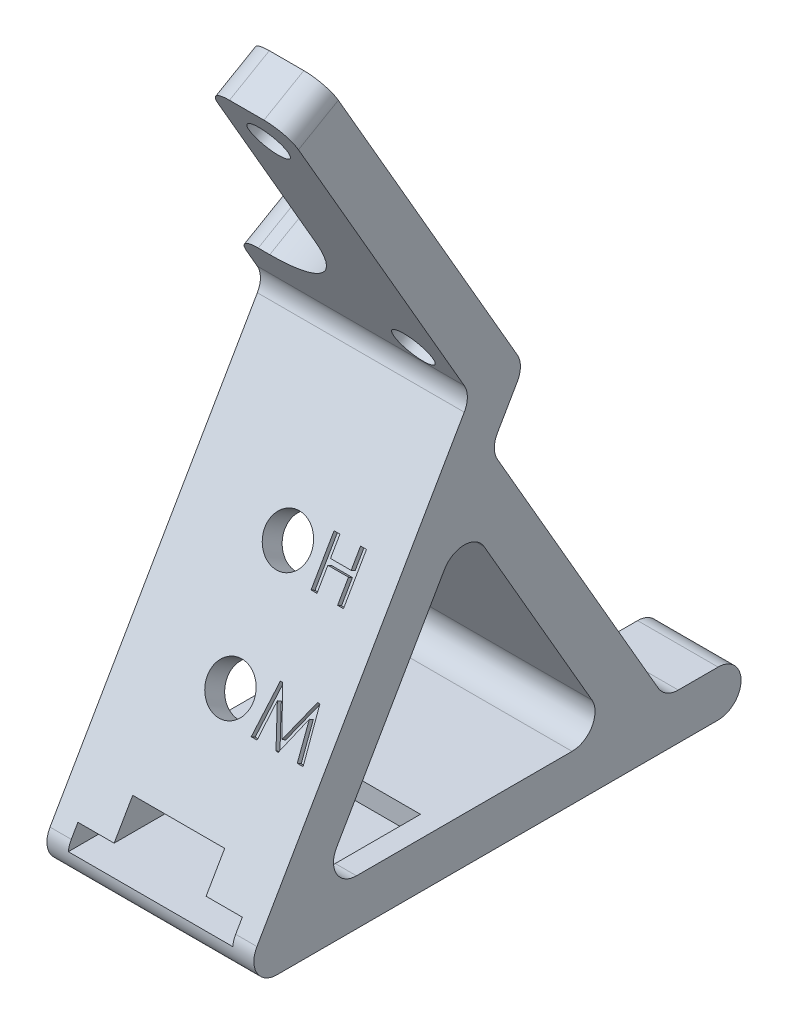
from build123d import *

# Parameters (mm, degrees)
BOSS_EXTRU_1_DEPTH      = 18
D_GAGEMENT_M31_D        = 3.4
ENL_V_MAT_EXTRU_5_REACH = 82.979
ESQUISSE7_W             = 11
ESQUISSE7_H             = 27
ENL_V_MAT_EXTRU_6_DEPTH = 11
ESQUISSE4_W             = 14.3
ESQUISSE4_H             = 17.809401077
ENL_V_MAT_EXTRU_1_DEPTH = 1.8
ENL_V_MAT_EXTRU_2_REACH = 83.214
ESQUISSE5_W             = 8
ESQUISSE5_H             = 2.8
ENL_V_MAT_EXTRU_3_REACH = 63.446
ENL_V_START             = -2
ESQUISSE6_W             = 7.2
ESQUISSE6_H             = 6.45
ENL_V_MAT_EXTRU_4_REACH = 61.446
ESQUISSE6_3_R           = 2
ENL_V_MAT_EXTRU_7_DEPTH = 0.4
CONG_1_R                = 2
CONG_2_R                = 8


with BuildPart() as part:
    # Esquisse1 → Boss.-Extru.1 (new body)
    with BuildSketch(Plane(origin=(0, 0, 0), x_dir=(0, 0, -1), z_dir=(1, 0, 0))):
        Polygon((-37.5, 64.951905284), (-40.964101615, 62.951905284), (-24.964101615, 35.239092363), (-45.309401077, 0), (0, 0), (-2.309401077, 4), (-8.082903769, 4), (-23.232050808, 30.239092363), (-20.345299462, 35.239092363), align=None)
        Polygon((-38.381197846, 4), (-12.701705922, 4), (-25.541451884, 26.239092363), align=None, mode=Mode.SUBTRACT)
    extrude(amount=BOSS_EXTRU_1_DEPTH)

    # Dégagement M31 (through all)
    with Locations(Plane(origin=(0, 0, 0), x_dir=(-1, 0, 0), z_dir=(0, 0.5000000000000047, -0.866025403784436))):
        with Locations((-14.5, 71.2), (-14.5, 46)):
            Hole(D_GAGEMENT_M31_D / 2)

    # Esquisse7 → Enlèv. mat.-Extru.5 (cut, up to next)
    with BuildSketch(Plane(origin=(0, -2, 3.464101615), x_dir=(1, 0, 0), z_dir=(0, -0.5000000000000047, 0.8660254037844359)), mode=Mode.PRIVATE) as enl_v_mat_extru_5_sk1:
        with Locations((5.5, 61.5)):
            Rectangle(ESQUISSE7_W, ESQUISSE7_H)
    enl_v_mat_extru_5_tool1 = extrude(enl_v_mat_extru_5_sk1.sketch, amount=-ENL_V_MAT_EXTRU_5_REACH, mode=Mode.PRIVATE) & part.part
    add(enl_v_mat_extru_5_tool1.solids().sort_by_distance((5.5, 51.260562, 34.214102))[0], mode=Mode.SUBTRACT)

    # Esquisse8 → Enlèv. mat.-Extru.6 (cut)
    with BuildSketch(Plane.ZY):
        Polygon((0, 0), (2.309401077, 4), (8.082903769, 4), (5.773502692, 0), align=None)
    extrude(amount=-ENL_V_MAT_EXTRU_6_DEPTH, mode=Mode.SUBTRACT)

    # Esquisse4 → Enlèv. mat.-Extru.1 (cut)
    with BuildSketch(Plane(origin=(0, 4, 0), x_dir=(1, 0, 0), z_dir=(0, 1, 0))):
        with Locations((9, -36.404700539)):
            Rectangle(ESQUISSE4_W, ESQUISSE4_H)
    extrude(amount=-ENL_V_MAT_EXTRU_1_DEPTH, mode=Mode.SUBTRACT)

    # Enlèv. mat.-Extru.2: up to this plane
    enl_v_mat_extru_2_end = Plane(origin=(18, 26.239092363, 25.541451884), z_dir=(0, -0.5000000000000034, -0.8660254037844367))
    # Esquisse5 → Enlèv. mat.-Extru.2 (cut, up to the surface)
    with BuildSketch(Plane(origin=(0, 0, 45.309401077), x_dir=(-1, 0, 0), z_dir=(0, 0, -1)), mode=Mode.PRIVATE) as enl_v_mat_extru_2_sk1:
        with Locations((-9, 5.4)):
            Rectangle(ESQUISSE5_W, ESQUISSE5_H)
    enl_v_mat_extru_2_tool1 = split(extrude(enl_v_mat_extru_2_sk1.sketch, amount=ENL_V_MAT_EXTRU_2_REACH, mode=Mode.PRIVATE), bisect_by=enl_v_mat_extru_2_end, keep=Keep.BOTH, mode=Mode.PRIVATE)
    add(enl_v_mat_extru_2_tool1.solids().sort_by_distance((9, 5.4, 45.309401))[0], mode=Mode.SUBTRACT)

    # Esquisse6 → Enlèv. mat.-Extru.3 (cut, up to next)
    with BuildSketch(Plane(origin=(0, 19.619546181, 33.982050808), x_dir=(1, 0, 0), z_dir=(0, 0.5000000000000042, 0.8660254037844363)).offset(ENL_V_START), mode=Mode.PRIVATE) as enl_v_mat_extru_3_sk1:
        with Locations((9, -5.802736877)):
            Rectangle(ESQUISSE6_W, ESQUISSE6_H)
    enl_v_mat_extru_3_tool1 = extrude(enl_v_mat_extru_3_sk1.sketch, amount=-ENL_V_MAT_EXTRU_3_REACH, mode=Mode.PRIVATE) & part.part
    # Esquisse6 → Enlèv. mat.-Extru.3 (cut, up to next)
    with BuildSketch(Plane(origin=(0, 19.619546181, 33.982050808), x_dir=(1, 0, 0), z_dir=(0, 0.5000000000000042, 0.8660254037844363)).offset(ENL_V_START), mode=Mode.PRIVATE) as enl_v_mat_extru_3_sk2:
        with Locations((9, 4.197263123)):
            Rectangle(ESQUISSE6_W, ESQUISSE6_H)
    enl_v_mat_extru_3_tool2 = extrude(enl_v_mat_extru_3_sk2.sketch, amount=-ENL_V_MAT_EXTRU_3_REACH, mode=Mode.PRIVATE) & part.part
    add(enl_v_mat_extru_3_tool1.solids().sort_by_distance((9, 13.594229, 35.151368))[0], mode=Mode.SUBTRACT)
    add(enl_v_mat_extru_3_tool2.solids().sort_by_distance((9, 22.254483, 30.151368))[0], mode=Mode.SUBTRACT)

    # Esquisse6<3> → Enlèv. mat.-Extru.4 (cut, up to next)
    with BuildSketch(Plane(origin=(0, 19.619546181, 33.982050808), x_dir=(1, 0, 0), z_dir=(0, 0.5000000000000042, 0.8660254037844363)), mode=Mode.PRIVATE) as enl_v_mat_extru_4_sk1:
        with Locations(Location((9, -5.802736877, 0), (0, 0, 270))):
            Circle(ESQUISSE6_3_R)
    enl_v_mat_extru_4_tool1 = extrude(enl_v_mat_extru_4_sk1.sketch, amount=-ENL_V_MAT_EXTRU_4_REACH, mode=Mode.PRIVATE) & part.part
    # Esquisse6<3> → Enlèv. mat.-Extru.4 (cut, up to next)
    with BuildSketch(Plane(origin=(0, 19.619546181, 33.982050808), x_dir=(1, 0, 0), z_dir=(0, 0.5000000000000042, 0.8660254037844363)), mode=Mode.PRIVATE) as enl_v_mat_extru_4_sk2:
        with Locations(Location((9, 4.197263123, 0), (0, 0, 270))):
            Circle(ESQUISSE6_3_R)
    enl_v_mat_extru_4_tool2 = extrude(enl_v_mat_extru_4_sk2.sketch, amount=-ENL_V_MAT_EXTRU_4_REACH, mode=Mode.PRIVATE) & part.part
    add(enl_v_mat_extru_4_tool1.solids().sort_by_distance((9, 14.594229, 36.883419))[0], mode=Mode.SUBTRACT)
    add(enl_v_mat_extru_4_tool2.solids().sort_by_distance((9, 23.254483, 31.883419))[0], mode=Mode.SUBTRACT)

    # Esquisse9 → Enlèv. mat.-Extru.7 (cut)
    with BuildSketch(Plane(origin=(0, 19.619546181, 33.982050808), x_dir=(1, 0, 0), z_dir=(0, 0.5000000000000042, 0.8660254037844363))):
        Polygon((12.012820513, 6.197263123), (12.525641026, 6.197263123), (12.525641026, 4.556237482), (14.320512821, 4.556237482), (14.320512821, 6.197263123), (14.833333333, 6.197263123), (14.833333333, 2.197263123), (14.320512821, 2.197263123), (14.320512821, 4.09469902), (12.525641026, 4.09469902), (12.525641026, 2.197263123), (12.012820513, 2.197263123), align=None)
        Polygon((11.807692308, -7.802736877), (12.342147436, -3.802736877), (12.544070513, -3.802736877), (14.060897436, -6.982224057), (15.577724359, -3.802736877), (15.782852564, -3.802736877), (16.320512821, -7.802736877), (15.811698718, -7.802736877), (15.455929487, -4.982224057), (14.157852564, -7.802736877), (13.963942308, -7.802736877), (12.669871795, -4.982224057), (12.315705128, -7.802736877), align=None)
    extrude(amount=-ENL_V_MAT_EXTRU_7_DEPTH, mode=Mode.SUBTRACT)

    # Congé1
    # the kernel refuses this fillet: 2 mm, written as the material it adds along each edge
    with BuildSketch(Plane(origin=(0, 4, 38.381197846), x_dir=(0, 0.8660254037844363, -0.5000000000000039), z_dir=(1, 0, 0)), Plane(origin=(16.15, 4, 38.381197846), x_dir=(0, 0.8660254037844363, -0.5000000000000039), z_dir=(1, 0, 0))) as cong_1_piece_1:
        with BuildLine():
            CenterArc((CONG_1_R * 1.73205080757, -CONG_1_R), CONG_1_R, 90, 120)
            Line((CONG_1_R * 0.866025403784, -CONG_1_R * 1.5), (0, 0))
            Line((0, 0), (CONG_1_R * 1.73205080757, 0))
        make_face()
    extrude(amount=1.85)
    with BuildSketch(Plane(origin=(0, 4, 12.701705922), x_dir=(0, 0.8660254037844365, 0.5000000000000036), z_dir=(1, 0, 0))) as cong_1_piece_2:
        with BuildLine():
            CenterArc((CONG_1_R * 1.73205080757, CONG_1_R), CONG_1_R, 150, 120)
            Line((CONG_1_R * 0.866025403784, CONG_1_R * 1.5), (0, 0))
            Line((0, 0), (CONG_1_R * 1.73205080757, 0))
        make_face()
    extrude(amount=18)
    with BuildSketch(Plane(origin=(0, 26.239092363, 25.541451884), x_dir=(0, -0.8660254037844365, 0.500000000000004), z_dir=(1, 0, 0))) as cong_1_piece_3_section:
        with BuildLine():
            CenterArc((CONG_1_R * 1.73205080757, CONG_1_R), CONG_1_R, 150, 120)
            Line((CONG_1_R * 0.866025403784, CONG_1_R * 1.5), (0, 0))
            Line((0, 0), (CONG_1_R * 1.73205080757, 0))
        make_face()
    cong_1_piece_3 = extrude(amount=26.660254038, mode=Mode.PRIVATE)
    cong_1_piece_3 = split(cong_1_piece_3, bisect_by=Plane(origin=(5.4, 23.813443604, 26.862688053), z_dir=(-1, 0, 0)), keep=Keep.TOP, mode=Mode.PRIVATE)
    add(cong_1_piece_3)
    with BuildSketch(Plane(origin=(-8.660254038, 26.239092363, 25.541451884), x_dir=(0, -0.8660254037844365, 0.500000000000004), z_dir=(1, 0, 0))) as cong_1_piece_4_section:
        with BuildLine():
            CenterArc((CONG_1_R * 1.73205080757, CONG_1_R), CONG_1_R, 150, 120)
            Line((CONG_1_R * 0.866025403784, CONG_1_R * 1.5), (0, 0))
            Line((0, 0), (CONG_1_R * 1.73205080757, 0))
        make_face()
    cong_1_piece_4 = extrude(amount=26.660254038, mode=Mode.PRIVATE)
    cong_1_piece_4 = split(cong_1_piece_4, bisect_by=Plane(origin=(9, 23.670920351, 26.154710464), z_dir=(0, 0.8660254037844363, -0.5000000000000042)), keep=Keep.TOP, mode=Mode.PRIVATE)
    cong_1_piece_4 = split(cong_1_piece_4, bisect_by=Plane(origin=(5.4, 24.793273023, 25.506719847), z_dir=(1, 0, 0)), keep=Keep.TOP, mode=Mode.PRIVATE)
    add(cong_1_piece_4)
    with BuildSketch(Plane(origin=(-8.660254038, 26.239092363, 25.541451884), x_dir=(0, -0.8660254037844365, 0.500000000000004), z_dir=(1, 0, 0))) as cong_1_piece_5_section:
        with BuildLine():
            CenterArc((CONG_1_R * 1.73205080757, CONG_1_R), CONG_1_R, 150, 120)
            Line((CONG_1_R * 0.866025403784, CONG_1_R * 1.5), (0, 0))
            Line((0, 0), (CONG_1_R * 1.73205080757, 0))
        make_face()
    cong_1_piece_5 = extrude(amount=26.660254038, mode=Mode.PRIVATE)
    cong_1_piece_5 = split(cong_1_piece_5, bisect_by=Plane(origin=(12.6, 23.813443604, 26.862688053), z_dir=(1, 0, 0)), keep=Keep.TOP, mode=Mode.PRIVATE)
    add(cong_1_piece_5)
    with BuildSketch(Plane(origin=(0, 35.239092363, 24.964101615), x_dir=(0, 0.8660254037844364, 0.5000000000000042), z_dir=(1, 0, 0)), Plane(origin=(0, 30.239092363, 23.232050808), x_dir=(0, -0.8660254037844379, -0.5000000000000012), z_dir=(1, 0, 0))) as cong_1_piece_6:
        with BuildLine():
            CenterArc((CONG_1_R * 0.57735026919, CONG_1_R), CONG_1_R, 210, 60)
            Line((-CONG_1_R * 0.288675134595, CONG_1_R * 0.5), (0, 0))
            Line((0, 0), (CONG_1_R * 0.57735026919, 0))
        make_face()
    extrude(amount=18)
    with BuildSketch(Plane(origin=(11, 4, 8.082903769), x_dir=(0, 0, -1), z_dir=(1, 0, 0))) as cong_1_piece_7:
        with BuildLine():
            CenterArc((CONG_1_R * 0.57735026919, CONG_1_R), CONG_1_R, 210, 60)
            Line((-CONG_1_R * 0.288675134595, CONG_1_R * 0.5), (0, 0))
            Line((0, 0), (CONG_1_R * 0.57735026919, 0))
        make_face()
    extrude(amount=7)
    # the kernel refuses this fillet: 2 mm, written as the material it takes off along each edge
    with BuildSketch(Plane(origin=(-8.660254038, 0, 45.309401077), x_dir=(0, 0, -1), z_dir=(1, 0, 0))) as cong_1_2_piece_1:
        with BuildLine():
            CenterArc((CONG_1_R * 1.73205080757, CONG_1_R), CONG_1_R, 150, 120)
            Line((CONG_1_R * 0.866025403784, CONG_1_R * 1.5), (0, 0))
            Line((0, 0), (CONG_1_R * 1.73205080757, 0))
        make_face()
    extrude(amount=35.320508076, mode=Mode.SUBTRACT)
    with BuildSketch(Plane(origin=(18, 67.451905284, 33.169872981), x_dir=(-1, 0, 0), z_dir=(0, -0.5000000000000019, 0.8660254037844376)), Plane(origin=(0, 37.069219382, 31.794228634), x_dir=(1, 0, 0), z_dir=(0, 0.5000000000000047, -0.8660254037844359)), Plane(origin=(11, 60.451905284, 45.294228634), x_dir=(1, 0, 0), z_dir=(0, 0.5000000000000047, -0.8660254037844359))) as cong_1_2_piece_2:
        with BuildLine():
            CenterArc((CONG_1_R, CONG_1_R), CONG_1_R, 180, 90)
            Line((0, CONG_1_R), (0, 0))
            Line((0, 0), (CONG_1_R, 0))
        make_face()
    extrude(amount=14, mode=Mode.SUBTRACT)
    with BuildSketch(Plane(origin=(-2.886751346, 35.239092363, 20.345299462), x_dir=(0, 0.866025403784436, 0.5000000000000046), z_dir=(1, 0, 0))) as cong_1_2_piece_3:
        with BuildLine():
            CenterArc((CONG_1_R * 0.57735026919, CONG_1_R), CONG_1_R, 210, 60)
            Line((-CONG_1_R * 0.288675134595, CONG_1_R * 0.5), (0, 0))
            Line((0, 0), (CONG_1_R * 0.57735026919, 0))
        make_face()
    extrude(amount=23.773502692, mode=Mode.SUBTRACT)
    with BuildSketch(Plane(origin=(8.113248654, 4, 2.309401077), x_dir=(0, 0, 1), z_dir=(1, 0, 0))) as cong_1_2_piece_4:
        with BuildLine():
            CenterArc((CONG_1_R * 0.57735026919, CONG_1_R), CONG_1_R, 210, 60)
            Line((-CONG_1_R * 0.288675134595, CONG_1_R * 0.5), (0, 0))
            Line((0, 0), (CONG_1_R * 0.57735026919, 0))
        make_face()
    extrude(amount=12.773502692, mode=Mode.SUBTRACT)
    with BuildSketch(Plane(origin=(2.339745962, 0, 0), x_dir=(0, 0.8660254037844364, 0.500000000000004), z_dir=(1, 0, 0))) as cong_1_2_piece_5:
        with BuildLine():
            CenterArc((CONG_1_R * 1.73205080757, CONG_1_R), CONG_1_R, 150, 120)
            Line((CONG_1_R * 0.866025403784, CONG_1_R * 1.5), (0, 0))
            Line((0, 0), (CONG_1_R * 1.73205080757, 0))
        make_face()
    extrude(amount=24.320508076, mode=Mode.SUBTRACT)
    with BuildSketch(Plane(origin=(-8.660254038, 0, 5.773502692), x_dir=(0, 0.8660254037844365, 0.5000000000000038), z_dir=(1, 0, 0))) as cong_1_2_piece_6:
        with BuildLine():
            CenterArc((CONG_1_R * 1.73205080757, CONG_1_R), CONG_1_R, 150, 120)
            Line((CONG_1_R * 0.866025403784, CONG_1_R * 1.5), (0, 0))
            Line((0, 0), (CONG_1_R * 1.73205080757, 0))
        make_face()
    extrude(amount=19.660254038, mode=Mode.SUBTRACT)

    # Congé2
    cong_2_edges = [part.edges().sort_by_distance(p)[0] for p in [
        (11, 40.569219382, 25.732050808),
    ]]
    fillet(cong_2_edges, radius=CONG_2_R)


solid = part.part
